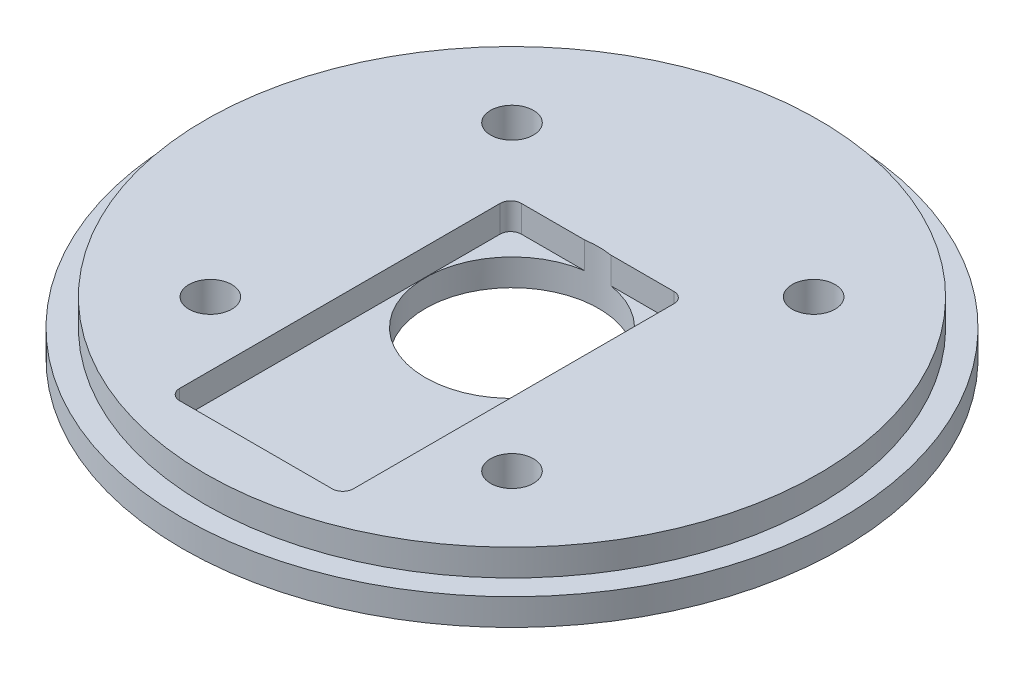
from build123d import *

# Parameters (mm, degrees)
SKETCH2_R                       = 39.243
BOSS_EXTRUDE1_DEPTH             = 6.35
CUT_EXTRUDE1_START              = -3.175
SKETCH4_R                       = 39.243
SKETCH4_R_2                     = 36.5125
CUT_EXTRUDE1_DEPTH              = 3.175
TAP_DRILL_FOR_1_4_20_TAP1_D     = 5.1054
F_13_16_0_8125_DIAMETER_HOLE1_D = 20.6375
SKETCH9_R                       = 6.35
CUT_EXTRUDE2_DEPTH              = 1.5875
SKETCH11_W                      = 20.7
SKETCH11_H                      = 40.7
CUT_EXTRUDE3_DEPTH              = 3.175
FILLET1_R                       = 1.27


with BuildPart() as part:
    # Sketch2 → Boss-Extrude1 (new body)
    with BuildSketch(Plane(origin=(0, 0, 0), x_dir=(1, 0, 0), z_dir=(0, 1, 0))):
        Circle(SKETCH2_R)
    extrude(amount=BOSS_EXTRUDE1_DEPTH)

    # Sketch4 → Cut-Extrude1 (cut)
    with BuildSketch(Plane(origin=(0, 6.35, 0), x_dir=(1, 0, 0), z_dir=(0, 1, 0)).offset(CUT_EXTRUDE1_START)):
        Circle(SKETCH4_R)
        Circle(SKETCH4_R_2, mode=Mode.SUBTRACT)
    extrude(amount=CUT_EXTRUDE1_DEPTH, mode=Mode.SUBTRACT)

    # Tap Drill for 1/4-20 Tap1 (through all)
    with Locations(Plane(origin=(0, 6.35, 0), x_dir=(1, 0, 0), z_dir=(0, 1, 0))):
        with Locations((-17.960512242, 17.960512242), (-17.960512242, -17.960512242), (17.960512242, 17.960512242), (17.960512242, -17.960512242)):
            Hole(TAP_DRILL_FOR_1_4_20_TAP1_D / 2)

    # 13/16 (0.8125) Diameter Hole1 (through all)
    with Locations(Plane(origin=(0, 6.35, 0), x_dir=(1, 0, 0), z_dir=(0, 1, 0))):
        with Locations((0, 0)):
            Hole(F_13_16_0_8125_DIAMETER_HOLE1_D / 2)

    # Sketch9 → Cut-Extrude2 (cut)
    with BuildSketch(Plane.XZ):
        with Locations((-17.960512242, 17.960512242)):
            Circle(SKETCH9_R)
        with Locations((17.960512242, 17.960512242)):
            Circle(SKETCH9_R)
        with Locations((17.960512242, -17.960512242)):
            Circle(SKETCH9_R)
        with Locations((-17.960512242, -17.960512242)):
            Circle(SKETCH9_R)
    extrude(amount=-CUT_EXTRUDE2_DEPTH, mode=Mode.SUBTRACT)

    # Sketch11 → Cut-Extrude3 (cut)
    with BuildSketch(Plane(origin=(0, 6.35, 0), x_dir=(1, 0, 0), z_dir=(0, 1, 0))):
        with Locations((0, -10.15)):
            Rectangle(SKETCH11_W, SKETCH11_H)
    extrude(amount=-CUT_EXTRUDE3_DEPTH, mode=Mode.SUBTRACT)

    # Fillet1
    fillet1_edges = [part.edges().sort_by_distance(p)[0] for p in [
        (-10.35, 4.7625, -10.2),
        (-10.35, 4.7625, 30.5),
        (10.35, 4.7625, 30.5),
        (10.35, 4.7625, -10.2),
    ]]
    fillet(fillet1_edges, radius=FILLET1_R)


solid = part.part
